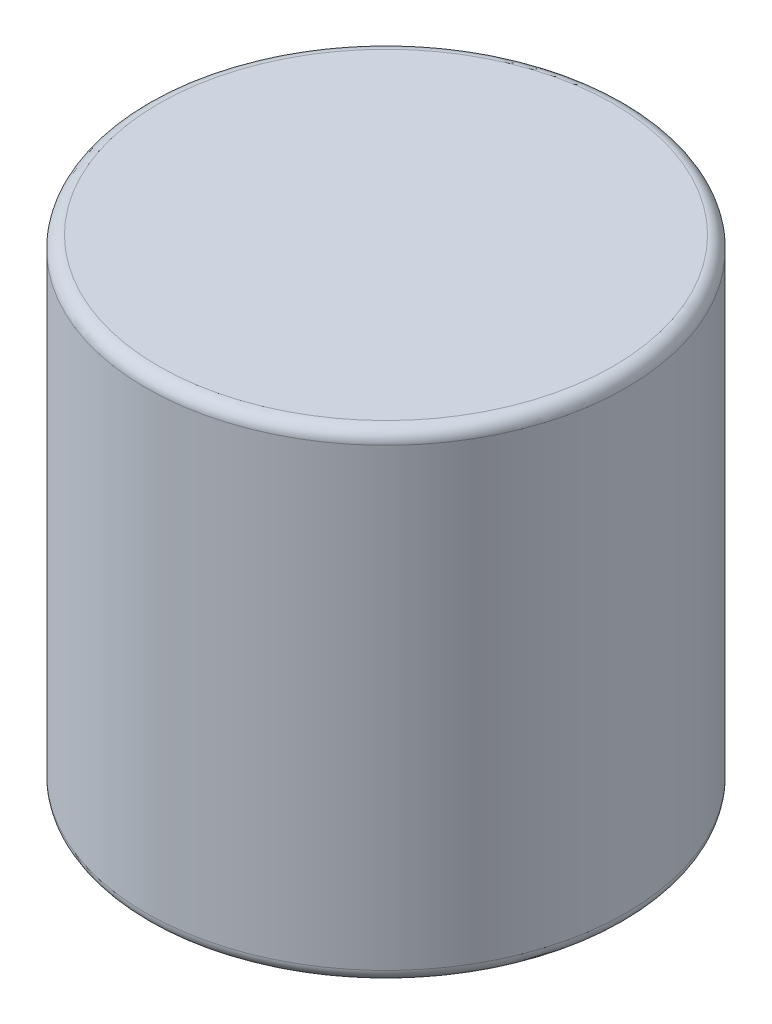
from build123d import *

# Parameters (mm, degrees)
SKETCH1_R           = 4.7625
BOSS_EXTRUDE1_DEPTH = 9.525
FILLET1_R           = 0.25


with BuildPart() as part:
    # Sketch1 → Boss-Extrude1 (new body)
    with BuildSketch(Plane(origin=(0, 0, 0), x_dir=(1, 0, 0), z_dir=(0, 1, 0))):
        Circle(SKETCH1_R)
    extrude(amount=BOSS_EXTRUDE1_DEPTH)

    # Fillet1
    fillet1_edges = [part.edges().sort_by_distance(p)[0] for p in [
        (-4.7625, 0, 0),
        (-4.7625, 9.525, 0),
    ]]
    fillet(fillet1_edges, radius=FILLET1_R)


solid = part.part
